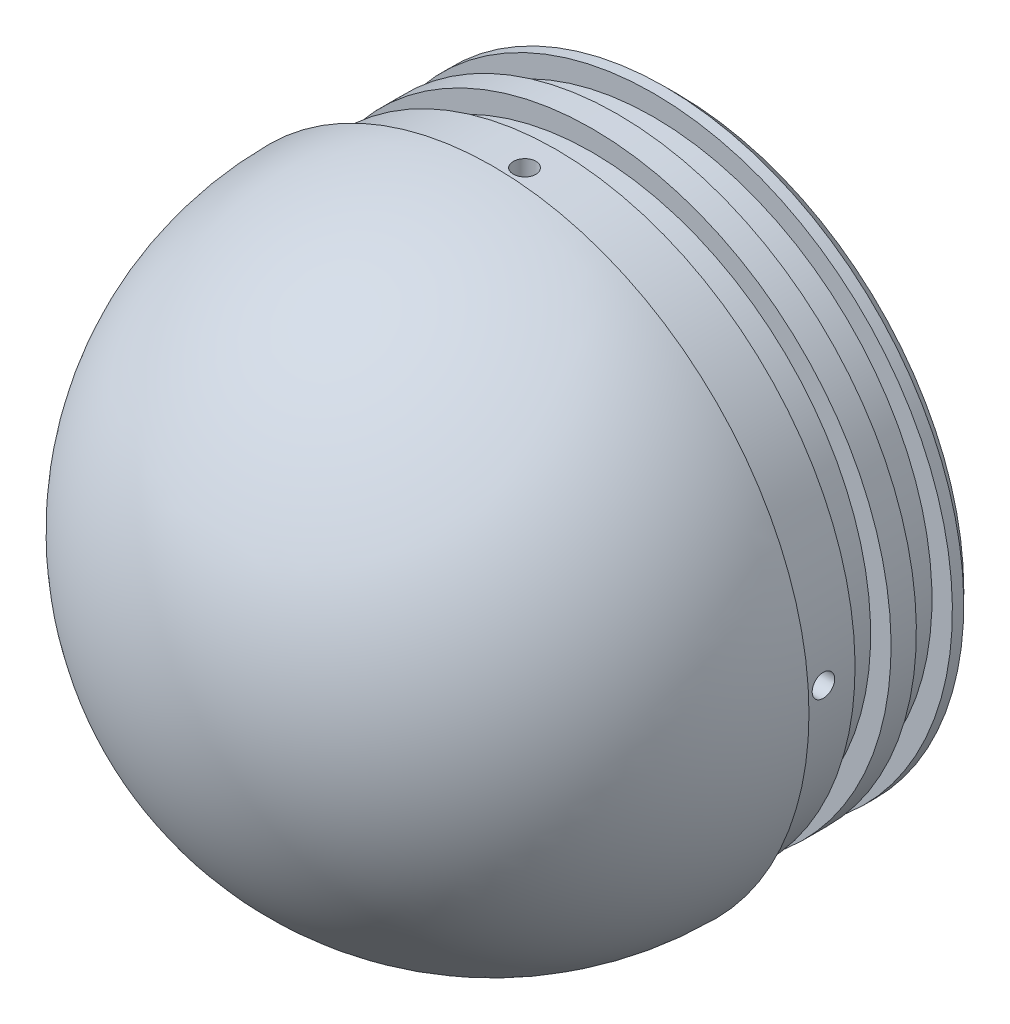
from build123d import *

# Parameters (mm, degrees)
F_4_40_TAPPED_HOLE1_D               = 2.2606
F_4_40_TAPPED_HOLE1_DEPTH           = 7.62
F_4_40_TAPPED_HOLE1_TIP             = 0.679152758
F_4_40_TAPPED_HOLE1_ON_FACE_2_D     = 2.2606
F_4_40_TAPPED_HOLE1_ON_FACE_2_DEPTH = 7.62
F_4_40_TAPPED_HOLE1_ON_FACE_2_TIP   = 0.679152758
F_4_40_TAPPED_HOLE1_ON_FACE_3_D     = 2.2606
F_4_40_TAPPED_HOLE1_ON_FACE_3_DEPTH = 7.62
F_4_40_TAPPED_HOLE1_ON_FACE_3_TIP   = 0.679152758
F_4_40_TAPPED_HOLE1_ON_FACE_4_D     = 2.2606
F_4_40_TAPPED_HOLE1_ON_FACE_4_DEPTH = 7.62
F_4_40_TAPPED_HOLE1_ON_FACE_4_TIP   = 0.679152758
SKETCH10_R                          = 20.50415
CUT_EXTRUDE3_DEPTH                  = 31.75
F_4_40_TAPPED_HOLE2_D               = 2.2606
F_4_40_TAPPED_HOLE2_DEPTH           = 7.62
F_4_40_TAPPED_HOLE2_TIP             = 0.679152758
CHAMFER1_SIZE                       = 1.27


with BuildPart() as part:
    # Sketch2 → Revolve1 (revolve)
    with BuildSketch(Plane(origin=(0, 0, 0), x_dir=(0, 0, -1), z_dir=(1, 0, 0))):
        Polygon((-18.542, 30.02915), (-12.192, 30.02915), (-12.192, 27.9781), (-8.5725, 27.9781), (-8.5725, 30.02915), (-6.0325, 30.02915), (-6.0325, 27.9781), (-2.413, 27.9781), (-2.413, 30.02915), (0, 30.02915), (0, 0), (-18.542, 0), align=None)
    revolve(axis=Axis((0, 0, 0), (0, 0, 1)))

    # #4-40 Tapped Hole1
    with Locations(Plane(origin=(0, -30.02915, 15.367), x_dir=(0, 0, -1), z_dir=(0, -1, 0))):
        with Locations((0, 0)):
            Hole(F_4_40_TAPPED_HOLE1_D / 2, depth=F_4_40_TAPPED_HOLE1_DEPTH)
            with Locations((0, 0, -(F_4_40_TAPPED_HOLE1_DEPTH + F_4_40_TAPPED_HOLE1_TIP / 2))):  # 118° drill point
                Cone(0, F_4_40_TAPPED_HOLE1_D / 2, F_4_40_TAPPED_HOLE1_TIP, mode=Mode.SUBTRACT)

    # #4-40 Tapped Hole1 on face 2
    with Locations(Plane(origin=(30.02915, 0, 15.367), x_dir=(0, 0, 1), z_dir=(1, 0, 0))):
        with Locations((0, 0)):
            Hole(F_4_40_TAPPED_HOLE1_ON_FACE_2_D / 2, depth=F_4_40_TAPPED_HOLE1_ON_FACE_2_DEPTH)
            with Locations((0, 0, -(F_4_40_TAPPED_HOLE1_ON_FACE_2_DEPTH + F_4_40_TAPPED_HOLE1_ON_FACE_2_TIP / 2))):  # 118° drill point
                Cone(0, F_4_40_TAPPED_HOLE1_ON_FACE_2_D / 2, F_4_40_TAPPED_HOLE1_ON_FACE_2_TIP, mode=Mode.SUBTRACT)

    # #4-40 Tapped Hole1 on face 3
    with Locations(Plane(origin=(-30.02915, 0, 15.367), x_dir=(0, 0, -1), z_dir=(-1, 0, 0))):
        with Locations((0, 0)):
            Hole(F_4_40_TAPPED_HOLE1_ON_FACE_3_D / 2, depth=F_4_40_TAPPED_HOLE1_ON_FACE_3_DEPTH)
            with Locations((0, 0, -(F_4_40_TAPPED_HOLE1_ON_FACE_3_DEPTH + F_4_40_TAPPED_HOLE1_ON_FACE_3_TIP / 2))):  # 118° drill point
                Cone(0, F_4_40_TAPPED_HOLE1_ON_FACE_3_D / 2, F_4_40_TAPPED_HOLE1_ON_FACE_3_TIP, mode=Mode.SUBTRACT)

    # #4-40 Tapped Hole1 on face 4
    with Locations(Plane(origin=(0, 30.02915, 15.367), x_dir=(0, 0, 1), z_dir=(0, 1, 0))):
        with Locations((0, 0)):
            Hole(F_4_40_TAPPED_HOLE1_ON_FACE_4_D / 2, depth=F_4_40_TAPPED_HOLE1_ON_FACE_4_DEPTH)
            with Locations((0, 0, -(F_4_40_TAPPED_HOLE1_ON_FACE_4_DEPTH + F_4_40_TAPPED_HOLE1_ON_FACE_4_TIP / 2))):  # 118° drill point
                Cone(0, F_4_40_TAPPED_HOLE1_ON_FACE_4_D / 2, F_4_40_TAPPED_HOLE1_ON_FACE_4_TIP, mode=Mode.SUBTRACT)

    # Sketch6 → Revolve2 (revolve)
    with BuildSketch(Plane(origin=(0, 0, 0), x_dir=(1, 0, 0), z_dir=(0, 1, 0))):
        with BuildLine():
            Line((0, -18.542), (31.75, -18.542))
            ThreePointArc((31.75, -18.542), (22.450640303, -40.992640303), (0, -50.292))
            Line((0, -50.292), (0, -18.542))
        make_face()
    revolve(axis=Axis((0, 0, 18.542), (0, 0, 1)))

    # Sketch10 → Cut-Extrude3 (cut)
    with BuildSketch(Plane(origin=(0, 0, 0), x_dir=(-1, 0, 0), z_dir=(0, 0, -1))):
        Circle(SKETCH10_R)
    extrude(amount=-CUT_EXTRUDE3_DEPTH, mode=Mode.SUBTRACT)

    # #4-40 Tapped Hole2
    with Locations(Plane(origin=(0, 0, 31.75), x_dir=(-1, 0, 0), z_dir=(0, 0, -1))):
        with Locations((0, 0)):
            Hole(F_4_40_TAPPED_HOLE2_D / 2, depth=F_4_40_TAPPED_HOLE2_DEPTH)
            with Locations((0, 0, -(F_4_40_TAPPED_HOLE2_DEPTH + F_4_40_TAPPED_HOLE2_TIP / 2))):  # 118° drill point
                Cone(0, F_4_40_TAPPED_HOLE2_D / 2, F_4_40_TAPPED_HOLE2_TIP, mode=Mode.SUBTRACT)

    # Chamfer1
    chamfer1_edges = [part.edges().sort_by_distance(p)[0] for p in [
        (0, -30.02915, 0),
    ]]
    chamfer(chamfer1_edges, length=CHAMFER1_SIZE)


solid = part.part
